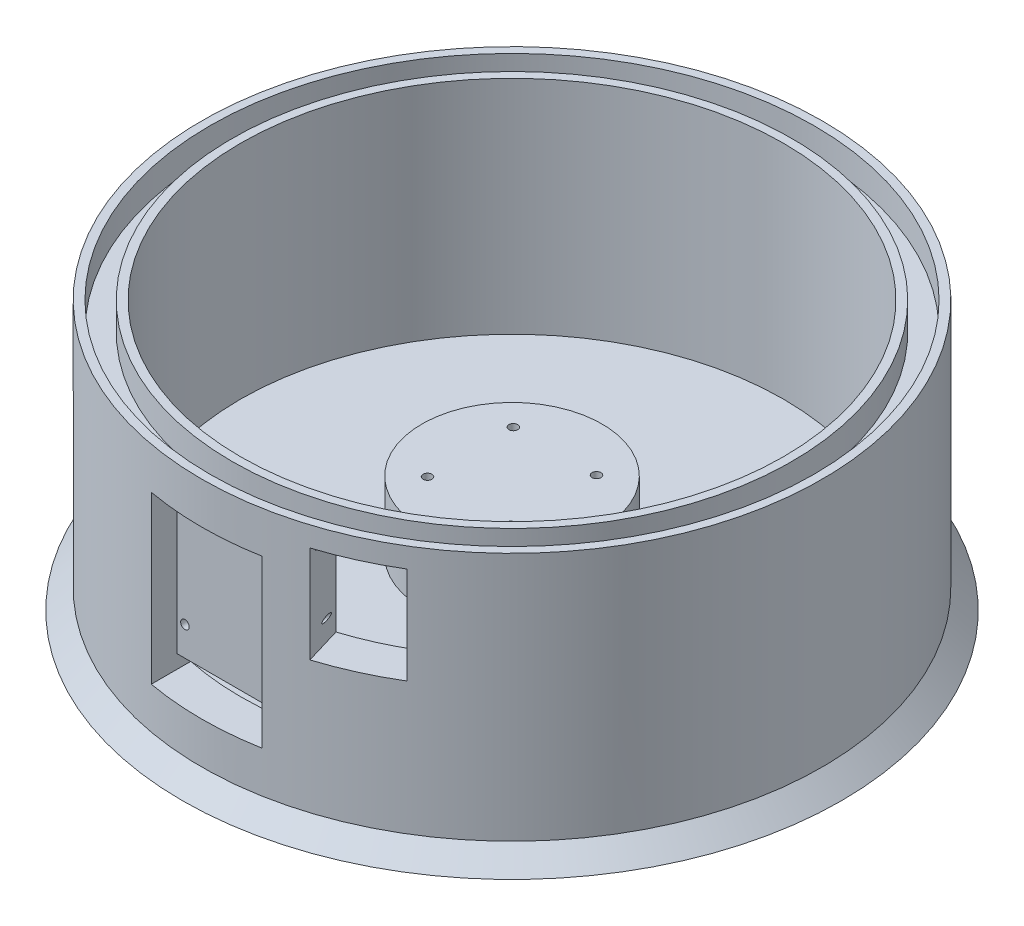
from build123d import *

# Parameters (mm, degrees)
SKETCH1_R               = 112
BOSS_EXTRUDE3_DEPTH     = 90
SKETCH9_R               = 109
SKETCH9_R_2             = 101
CUT_EXTRUDE6_DEPTH      = 10
CUT_EXTRUDE2_DEPTH      = 26
CUT_EXTRUDE2_DEPTH_BACK = 4
SKETCH4_W               = 40
SKETCH4_H               = 60
SKETCH12_R              = 112
BOSS_EXTRUDE4_DEPTH     = 7
BOSS_EXTRUDE4_DRAFT     = -45
SKETCH13_R              = 98
CUT_EXTRUDE8_DEPTH      = 80
SKETCH14_R              = 0.75
CUT_EXTRUDE9_DEPTH      = 15
SKETCH18_R              = 32.5
BOSS_EXTRUDE5_DEPTH     = 25
SKETCH16_R              = 1.6
CUT_EXTRUDE11_DEPTH     = 195.244691097
SKETCH17_R              = 3
CUT_EXTRUDE12_DEPTH     = 30
SKETCH19_R              = 30
CUT_EXTRUDE13_DEPTH     = 25
SKETCH20_W              = 40
SKETCH20_H              = 5
CUT_EXTRUDE14_DEPTH     = 25
SKETCH21_R              = 1.55
CUT_EXTRUDE15_DEPTH     = 25
CUT_EXTRUDE16_DEPTH     = 35


with BuildPart() as part:
    # Sketch1 → Boss-Extrude3 (new body)
    with BuildSketch(Plane(origin=(0, 0, 0), x_dir=(1, 0, 0), z_dir=(0, 1, 0))):
        Circle(SKETCH1_R)
    extrude(amount=BOSS_EXTRUDE3_DEPTH)

    # Sketch9 → Cut-Extrude6 (cut)
    with BuildSketch(Plane(origin=(0, 90, 0), x_dir=(1, 0, 0), z_dir=(0, 1, 0))):
        Circle(SKETCH9_R)
        Circle(SKETCH9_R_2, mode=Mode.SUBTRACT)
    extrude(amount=-CUT_EXTRUDE6_DEPTH, mode=Mode.SUBTRACT)

    # Sketch4 → Cut-Extrude2 (cut, two sides: drawn at the far end of the back side and taken through both)
    with BuildSketch(Plane.XY.offset(105).offset(-CUT_EXTRUDE2_DEPTH_BACK)):
        with Locations((0, 45)):
            Rectangle(SKETCH4_W, SKETCH4_H)
    extrude(amount=CUT_EXTRUDE2_DEPTH + CUT_EXTRUDE2_DEPTH_BACK, mode=Mode.SUBTRACT)


with BuildPart() as boss_extrude4_tool:
    # Sketch12 → Boss-Extrude4 (with draft: the straight prism first)
    with BuildSketch(Plane.XZ):
        Circle(SKETCH12_R)
    extrude(amount=BOSS_EXTRUDE4_DEPTH)
    # Boss-Extrude4: the draft: its side faces are tilted about the plane it starts from
    boss_extrude4_sides = [boss_extrude4_tool.faces().sort_by_distance(p)[0] for p in [
        (-112, -3.5, 0),
    ]]
    draft(boss_extrude4_sides, Plane.XZ, BOSS_EXTRUDE4_DRAFT)


with BuildPart() as part_1:
    add(part.part)

    # Boss-Extrude4: add boss_extrude4_tool
    add(boss_extrude4_tool.part)

    # Sketch13 → Cut-Extrude8 (cut)
    with BuildSketch(Plane(origin=(0, 90, 0), x_dir=(1, 0, 0), z_dir=(0, 1, 0))):
        Circle(SKETCH13_R)
    extrude(amount=-CUT_EXTRUDE8_DEPTH, mode=Mode.SUBTRACT)

    # Sketch14 → Cut-Extrude9 (cut)
    with BuildSketch(Plane.XY.offset(101)):
        with Locations((-31.25, 55.25)):
            Circle(SKETCH14_R)
        with Locations((31.25, 55.25)):
            Circle(SKETCH14_R)
        with Locations((31.25, 7.75)):
            Circle(SKETCH14_R)
        with Locations((-31.25, 7.75)):
            Circle(SKETCH14_R)
    extrude(amount=-CUT_EXTRUDE9_DEPTH, mode=Mode.SUBTRACT)

    # Sketch18 → Boss-Extrude5 (add)
    with BuildSketch(Plane(origin=(0, 10, 0), x_dir=(1, 0, 0), z_dir=(0, 1, 0))):
        Circle(SKETCH18_R)
    extrude(amount=BOSS_EXTRUDE5_DEPTH)

    # Sketch16 → Cut-Extrude11 (cut, through all)
    with BuildSketch(Plane.XZ.offset(7)):
        with Locations((-15, 15.5)):
            Circle(SKETCH16_R)
        with Locations((15, 15.5)):
            Circle(SKETCH16_R)
        with Locations((15, -15.5)):
            Circle(SKETCH16_R)
        with Locations((-15, -15.5)):
            Circle(SKETCH16_R)
    extrude(amount=-CUT_EXTRUDE11_DEPTH, mode=Mode.SUBTRACT)

    # Sketch17 → Cut-Extrude12 (cut)
    with BuildSketch(Plane.XZ.offset(7)):
        with Locations((-15, 15.5)):
            Circle(SKETCH17_R)
        with Locations((15, 15.5)):
            Circle(SKETCH17_R)
        with Locations((-15, -15.5)):
            Circle(SKETCH17_R)
        with Locations((15, -15.5)):
            Circle(SKETCH17_R)
    extrude(amount=-CUT_EXTRUDE12_DEPTH, mode=Mode.SUBTRACT)

    # Sketch19 → Cut-Extrude13 (cut)
    with BuildSketch(Plane.XZ.offset(7)):
        Circle(SKETCH19_R)
    extrude(amount=-CUT_EXTRUDE13_DEPTH, mode=Mode.SUBTRACT)

    # Sketch20 → Cut-Extrude14 (cut)
    with BuildSketch(Plane.XY.offset(101)):
        with Locations((0, 17.5)):
            Rectangle(SKETCH20_W, SKETCH20_H)
    extrude(amount=-CUT_EXTRUDE14_DEPTH, mode=Mode.SUBTRACT)

    # Sketch21 → Cut-Extrude15 (cut)
    with BuildSketch(Plane.XY.offset(101)):
        with Locations((12.45, 67.8)):
            Circle(SKETCH21_R)
        with Locations((-12.45, 67.8)):
            Circle(SKETCH21_R)
        with Locations((-17.05, 30.54)):
            Circle(SKETCH21_R)
        with Locations((17.05, 30.54)):
            Circle(SKETCH21_R)
    extrude(amount=-CUT_EXTRUDE15_DEPTH, mode=Mode.SUBTRACT)

    # Sketch22 → Cut-Extrude16 (cut)
    with BuildSketch(Plane(origin=(22.204096953, 47.794122581, -296.404157649), x_dir=(1, 0, 0), z_dir=(0, 1, 0))):
        Polygon((-5.132228513, -347.374781927), (12.404969277, -405.762485644), (37.058002756, -394.3841625), (4.309803986, -343.062750167), align=None)
    extrude(amount=CUT_EXTRUDE16_DEPTH, mode=Mode.SUBTRACT)


solid = part_1.part
